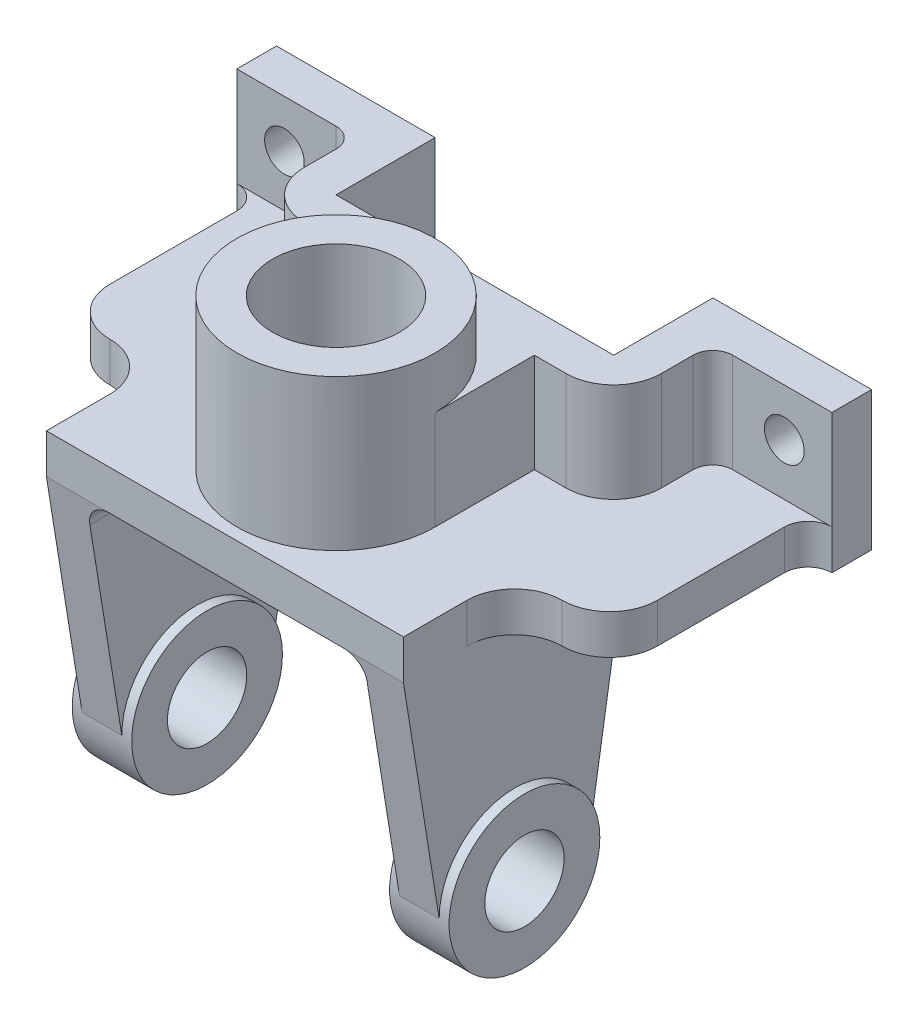
from build123d import *

# Parameters (mm, degrees)
SKETCH1_R           = 25
SKETCH1_R_2         = 16
BOSS_EXTRUDE1_DEPTH = 10
SKETCH1_8_R         = 25
SKETCH1_8_R_2       = 16
BOSS_EXTRUDE3_DEPTH = 35
SKETCH1_9_R         = 25
SKETCH1_9_R_2       = 16
BOSS_EXTRUDE4_DEPTH = 48
SKETCH7_R           = 10
BOSS_EXTRUDE5_DEPTH = 10
BOSS_EXTRUDE6_START = 2.5
SKETCH7_5_R         = 19
SKETCH7_5_R_2       = 10
BOSS_EXTRUDE6_DEPTH = 15
FILLET1_R           = 5
FILLET2_R           = 12
FILLET3_R           = 12
FILLET4_R           = 6
FILLET5_START       = 29.9999999
FILLET5_DEPTH       = 15.0000001
FILLET5_START_2     = 35
FILLET5_2_DEPTH     = 10
FILLET5_START_3     = -64
FILLET5_3_DEPTH     = 63.196428571
FILLET6_R           = 6
FILLET7_START       = -45
FILLET7_DEPTH       = 16
FILLET7_START_2     = -88
FILLET7_2_DEPTH     = 87.035714286
FILLET7_3_DEPTH     = 25
FILLET8_R           = 12
FILLET9_R           = 12
FILLET10_R          = 6
FILLET11_R          = 12
FILLET12_R          = 12
FILLET13_R          = 5
FILLET14_R          = 5
SKETCH11_R          = 5
CUT_EXTRUDE1_DEPTH  = 132.658649545


with BuildPart() as part:
    # Sketch1 → Boss-Extrude1 (new body)
    # profile 1 of 3: a face of its own
    with BuildSketch(Plane(origin=(0, 0, 0), x_dir=(1, 0, 0), z_dir=(0, 1, 0))):
        with BuildLine():
            Line((-45, 28), (-45, 0))
            Line((-45, 0), (45, 0))
            Line((45, 0), (45, 28))
            Line((45, 28), (69, 28))
            Line((69, 28), (69, 78))
            Line((69, 78), (45, 78))
            Line((45, 78), (45, 53))
            Line((45, 53), (25, 53))
            Line((25, 53), (25, 28))
            ThreePointArc((25, 28), (0, 3), (-25, 28))
            Line((-25, 28), (-25, 53))
            Line((-25, 53), (-45, 53))
            Line((-45, 53), (-45, 78))
            Line((-45, 78), (-69, 78))
            Line((-69, 78), (-69, 28))
            Line((-69, 28), (-45, 28))
        make_face()
    # profile 2 of 3: a face of its own
    with BuildSketch(Plane(origin=(0, 0, 0), x_dir=(1, 0, 0), z_dir=(0, 1, 0))):
        with Locations((0, 28)):
            Circle(SKETCH1_R)
        with Locations(Location((0, 28, 0), (0, 0, 270))):
            Circle(SKETCH1_R_2, mode=Mode.SUBTRACT)
    # profile 3 of 3: a face of its own
    with BuildSketch(Plane(origin=(0, 0, 0), x_dir=(1, 0, 0), z_dir=(0, 1, 0))):
        with BuildLine():
            Line((-75, 78), (-69, 78))
            Line((-69, 78), (-45, 78))
            Line((-45, 78), (-45, 53))
            Line((-45, 53), (-25, 53))
            Line((-25, 53), (-25, 28))
            ThreePointArc((-25, 28), (0, 53), (25, 28))
            Line((25, 28), (25, 53))
            Line((25, 53), (45, 53))
            Line((45, 53), (45, 78))
            Line((45, 78), (69, 78))
            Line((69, 78), (75, 78))
            Line((75, 78), (75, 88))
            Line((75, 88), (35, 88))
            Line((35, 88), (35, 63))
            Line((35, 63), (0, 63))
            Line((0, 63), (-35, 63))
            Line((-35, 63), (-35, 88))
            Line((-35, 88), (-75, 88))
            Line((-75, 88), (-75, 78))
        make_face()
    extrude(amount=BOSS_EXTRUDE1_DEPTH)

    # Sketch1<8> → Boss-Extrude3 (add)
    # profile 1 of 2: a face of its own
    with BuildSketch(Plane(origin=(0, 0, 0), x_dir=(1, 0, 0), z_dir=(0, 1, 0))):
        with BuildLine():
            Line((-75, 78), (-69, 78))
            Line((-69, 78), (-45, 78))
            Line((-45, 78), (-45, 53))
            Line((-45, 53), (-25, 53))
            Line((-25, 53), (-25, 28))
            ThreePointArc((-25, 28), (0, 53), (25, 28))
            Line((25, 28), (25, 53))
            Line((25, 53), (45, 53))
            Line((45, 53), (45, 78))
            Line((45, 78), (69, 78))
            Line((69, 78), (75, 78))
            Line((75, 78), (75, 88))
            Line((75, 88), (35, 88))
            Line((35, 88), (35, 63))
            Line((35, 63), (0, 63))
            Line((0, 63), (-35, 63))
            Line((-35, 63), (-35, 88))
            Line((-35, 88), (-75, 88))
            Line((-75, 88), (-75, 78))
        make_face()
    # profile 2 of 2: a face of its own
    with BuildSketch(Plane(origin=(0, 0, 0), x_dir=(1, 0, 0), z_dir=(0, 1, 0))):
        with Locations((0, 28)):
            Circle(SKETCH1_8_R)
        with Locations(Location((0, 28, 0), (0, 0, 270))):
            Circle(SKETCH1_8_R_2, mode=Mode.SUBTRACT)
    extrude(amount=BOSS_EXTRUDE3_DEPTH)

    # Sketch1<9> → Boss-Extrude4 (add)
    with BuildSketch(Plane(origin=(0, 0, 0), x_dir=(1, 0, 0), z_dir=(0, 1, 0))):
        with Locations((0, 28)):
            Circle(SKETCH1_9_R)
        with Locations(Location((0, 28, 0), (0, 0, 270))):
            Circle(SKETCH1_9_R_2, mode=Mode.SUBTRACT)
    extrude(amount=BOSS_EXTRUDE4_DEPTH)

    # Sketch7 → Boss-Extrude5 (add)
    with BuildSketch(Plane(origin=(45, 0, 0), x_dir=(0, 0, -1), z_dir=(1, 0, 0))):
        with BuildLine():
            Line((56, 0), (0, 0))
            Line((0, 0), (9, -56))
            ThreePointArc((9, -56), (28, -75), (47, -56))
            Line((47, -56), (56, 0))
        make_face()
        with Locations((28, -56)):
            Circle(SKETCH7_R, mode=Mode.SUBTRACT)
    boss_extrude5 = extrude(amount=-BOSS_EXTRUDE5_DEPTH)

    # Sketch7<5> → Boss-Extrude6 (add)
    with BuildSketch(Plane(origin=(45, 0, 0), x_dir=(0, 0, -1), z_dir=(1, 0, 0)).offset(BOSS_EXTRUDE6_START)):
        with Locations((28, -56)):
            Circle(SKETCH7_5_R)
        with Locations((28, -56)):
            Circle(SKETCH7_5_R_2, mode=Mode.SUBTRACT)
    boss_extrude6 = extrude(amount=-BOSS_EXTRUDE6_DEPTH)

    # Fillet1
    fillet1_edges = [part.edges().sort_by_distance(p)[0] for p in [
        (35, 0, -28),
    ]]
    fillet(fillet1_edges, radius=FILLET1_R)

    # Fillet2
    fillet2_edges = [part.edges().sort_by_distance(p)[0] for p in [
        (45, 5, -28),
    ]]
    fillet(fillet2_edges, radius=FILLET2_R)

    # Fillet3
    fillet3_edges = [part.edges().sort_by_distance(p)[0] for p in [
        (69, 5, -28),
    ]]
    fillet(fillet3_edges, radius=FILLET3_R - 0.0001)  # a hair under: the kernel refuses the full size

    # Fillet4
    fillet4_edges = [part.edges().sort_by_distance(p)[0] for p in [
        (69, 5, -78),
    ]]
    fillet(fillet4_edges, radius=FILLET4_R - 0.0001)  # a hair under: the kernel refuses the full size

    # Fillet5: read off the stored shape, not the designer's step
    # Fillet5 outline → Fillet5 (add)
    with BuildSketch(Plane.YZ.offset(FILLET5_START)):
        with BuildLine():
            ThreePointArc((-21.033047615, -52.619688776), (-11.709098144, -56.128625688), (-4.495715646, -63))
            Line((-4.495715646, -63), (0, -63))
            Line((0, -63), (0, -56))
            Line((0, -56), (-21.033047615, -52.619688776))
        make_face()
    extrude(amount=FILLET5_DEPTH)

    # Fillet5 2 outline → Fillet5 2 (add)
    with BuildSketch(Plane.YZ.offset(FILLET5_START_2)):
        with BuildLine():
            ThreePointArc((-4.495715646, -63), (-1.150397185, -69.806519203), (0, -77.302948058))
            Line((0, -77.302948058), (0, -63))
            Line((0, -63), (-4.495715646, -63))
        make_face()
    extrude(amount=FILLET5_2_DEPTH)

    # Fillet5 3 outline → Fillet5 3 (cut)
    with BuildSketch(Plane.XY.offset(FILLET5_START_3)):
        with BuildLine():
            Line((29.9999999, -23), (35, -23))
            Line((35, -23), (35, -5))
            ThreePointArc((35, -5), (33.535533906, -1.464466094), (30, 0))
            Line((30, 0), (29.9999999, -23))
        make_face()
    extrude(amount=FILLET5_3_DEPTH, mode=Mode.SUBTRACT)

    # Mirror2: Boss-Extrude5, Boss-Extrude6 across plane
    add(boss_extrude5.mirror(Plane(origin=(0, 0, 0), x_dir=(0, 0, 1), z_dir=(1, 0, 0))))
    add(boss_extrude6.mirror(Plane(origin=(0, 0, 0), x_dir=(0, 0, 1), z_dir=(1, 0, 0))))

    # Fillet6
    fillet6_edges = [part.edges().sort_by_distance(p)[0] for p in [
        (-35, 0, -28),
    ]]
    fillet(fillet6_edges, radius=FILLET6_R)

    # Fillet7: read off the stored shape, not the designer's step
    # Fillet7 outline → Fillet7 (add)
    with BuildSketch(Plane.YZ.offset(FILLET7_START)):
        with BuildLine():
            ThreePointArc((-21.033047615, -52.619688776), (-5.971418739, -61.088352929), (0, -77.302948058))
            Line((0, -77.302948058), (0, -56))
            Line((0, -56), (-21.033047615, -52.619688776))
        make_face()
    extrude(amount=FILLET7_DEPTH)

    # Fillet7 2 outline → Fillet7 2 (cut)
    with BuildSketch(Plane.XY.offset(FILLET7_START_2)):
        with BuildLine():
            Line((-29, -23), (-29, 0))
            ThreePointArc((-29, 0), (-33.242640687, -1.757359313), (-35, -6))
            Line((-35, -6), (-35, -23))
            Line((-35, -23), (-29, -23))
        make_face()
    extrude(amount=FILLET7_2_DEPTH, mode=Mode.SUBTRACT)

    # Fillet7 3 outline → Fillet7 3 (cut)
    with BuildSketch(Plane.XY.offset(FILLET7_START_2)):
        with BuildLine():
            Line((-29, 0), (-35, 0))
            Line((-35, 0), (-35, -6))
            ThreePointArc((-35, -6), (-33.242640687, -1.757359313), (-29, 0))
        make_face()
    extrude(amount=FILLET7_3_DEPTH, mode=Mode.SUBTRACT)

    # Fillet8
    fillet8_edges = [part.edges().sort_by_distance(p)[0] for p in [
        (-45, 5, -28),
    ]]
    fillet(fillet8_edges, radius=FILLET8_R)

    # Fillet9
    fillet9_edges = [part.edges().sort_by_distance(p)[0] for p in [
        (-69, 5, -28),
    ]]
    fillet(fillet9_edges, radius=FILLET9_R - 0.0001)  # a hair under: the kernel refuses the full size

    # Fillet10
    fillet10_edges = [part.edges().sort_by_distance(p)[0] for p in [
        (-69, 5, -78),
    ]]
    fillet(fillet10_edges, radius=FILLET10_R - 0.0001)  # a hair under: the kernel refuses the full size

    # Fillet11
    fillet11_edges = [part.edges().sort_by_distance(p)[0] for p in [
        (45, 22.5, -53),
    ]]
    fillet(fillet11_edges, radius=FILLET11_R)

    # Fillet12
    fillet12_edges = [part.edges().sort_by_distance(p)[0] for p in [
        (-45, 22.5, -53),
    ]]
    fillet(fillet12_edges, radius=FILLET12_R)

    # Fillet13
    fillet13_edges = [part.edges().sort_by_distance(p)[0] for p in [
        (45, 22.5, -78),
    ]]
    fillet(fillet13_edges, radius=FILLET13_R)

    # Fillet14
    fillet14_edges = [part.edges().sort_by_distance(p)[0] for p in [
        (-45, 22.5, -78),
    ]]
    fillet(fillet14_edges, radius=FILLET14_R)

    # Sketch11 → Cut-Extrude1 (cut, through all)
    with BuildSketch(Plane.XY.offset(-78)):
        with Locations((63, 23)):
            Circle(SKETCH11_R)
    cut_extrude1 = extrude(amount=-CUT_EXTRUDE1_DEPTH, mode=Mode.SUBTRACT)

    # Mirror8: Cut-Extrude1 across plane
    add(cut_extrude1.mirror(Plane(origin=(0, 0, 0), x_dir=(0, 0, 1), z_dir=(1, 0, 0))), mode=Mode.SUBTRACT)


solid = part.part
